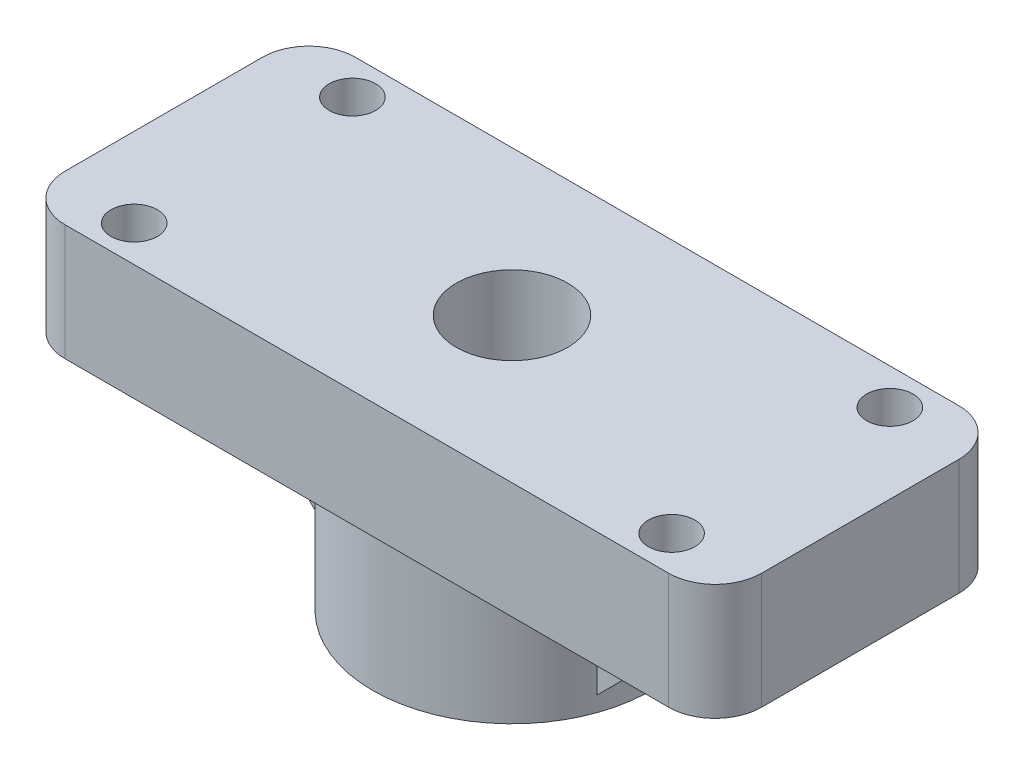
from build123d import *

# Parameters (mm, degrees)
SKETCH1_W            = 60
SKETCH1_H            = 25
BASE_DEPTH           = 10
PEN_HOLE_REACH       = 41.246
SKETCH5_R            = 4.8
STAB_FINS_DEPTH      = 4
STAB_FINS_DEPTH_BACK = 4
BASE_DEC_R           = 4
SKETCH8_R            = 2
CUT_EXTRUDE2_DEPTH   = 40.246018906


with BuildPart() as part:
    # Sketch1 → Base (new body)
    with BuildSketch(Plane(origin=(0, 0, 0), x_dir=(1, 0, 0), z_dir=(0, 1, 0))):
        Rectangle(SKETCH1_W, SKETCH1_H)
    extrude(amount=BASE_DEPTH)

    # Sketch2 → Pen Catch (revolve)
    with BuildSketch(Plane.XY):
        Polygon((-4.8, 0), (-4.8, -7), (-4.5, -7), (-4.5, -12), (-12, -12), (-12, 0), align=None)
    revolve(axis=Axis((0, 0, 0), (0, -1, 0)))

    # Sketch5 → Pen Hole (cut, up to next)
    with BuildSketch(Plane(origin=(0, 10, 0), x_dir=(1, 0, 0), z_dir=(0, 1, 0)), mode=Mode.PRIVATE) as pen_hole_sk1:
        Circle(SKETCH5_R)
    pen_hole_tool1 = extrude(pen_hole_sk1.sketch, amount=-PEN_HOLE_REACH, mode=Mode.PRIVATE) & part.part
    add(pen_hole_tool1.solids().sort_by_distance((0, 10, 0))[0], mode=Mode.SUBTRACT)

    # Sketch4 → Stab Fins (add, two sides: drawn at the far end of the back side and taken through both)
    with BuildSketch(Plane.XY.offset(-STAB_FINS_DEPTH_BACK)):
        Polygon((-22, 0), (-10, 0), (-10, -12), align=None)
        Polygon((10, -12), (22, 0), (10, 0), align=None)
    extrude(amount=STAB_FINS_DEPTH + STAB_FINS_DEPTH_BACK)

    # Base Dec
    base_dec_edges = [part.edges().sort_by_distance(p)[0] for p in [
        (-30, 5, -12.5),
        (30, 5, 12.5),
        (30, 5, -12.5),
        (-30, 5, 12.5),
    ]]
    fillet(base_dec_edges, radius=BASE_DEC_R)

    # Sketch8 → Cut-Extrude2 (cut, through all)
    with BuildSketch(Plane(origin=(0, 10, 0), x_dir=(1, 0, 0), z_dir=(0, 1, 0))):
        with Locations((23.15, 9.4)):
            Circle(SKETCH8_R)
        with Locations((23.15, -9.4)):
            Circle(SKETCH8_R)
        with Locations((-23.15, 9.4)):
            Circle(SKETCH8_R)
        with Locations((-23.15, -9.4)):
            Circle(SKETCH8_R)
    extrude(amount=-CUT_EXTRUDE2_DEPTH, mode=Mode.SUBTRACT)


solid = part.part
